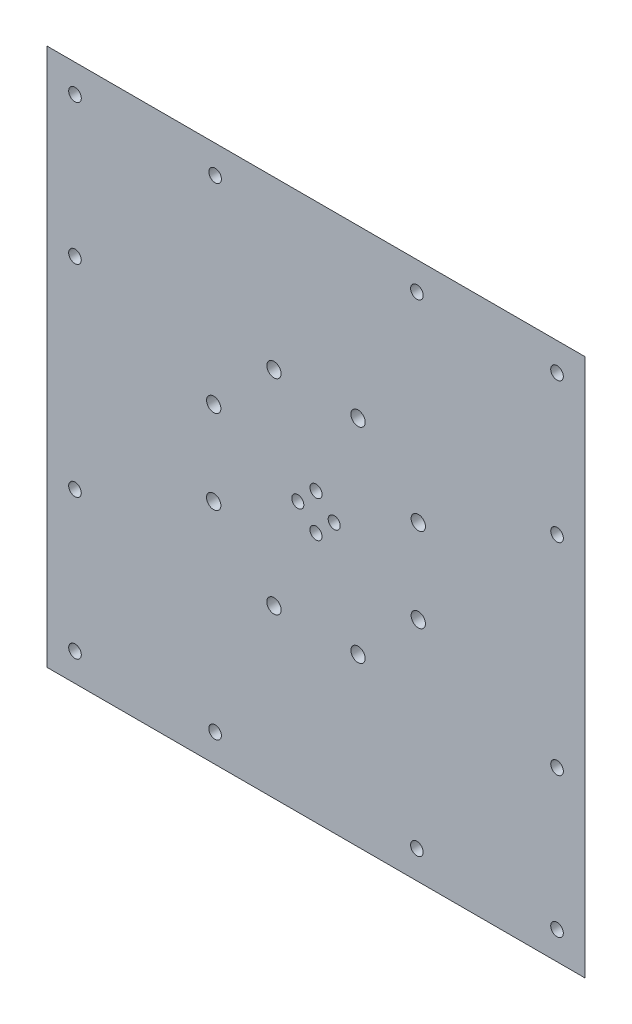
from build123d import *

# Parameters (mm, degrees)
SKETCH_1_W             = 200
SKETCH_1_H             = 200
EXTRUDE_1_DEPTH        = 3
SKETCH_5_W             = 200
SKETCH_5_H             = 200
EXTRUDE_2_DEPTH        = 3
SKETCH_2_R             = 2.55
SKETCH_2_R_2           = 2.15
CUT_EXTRUDE_1_DEPTH    = 10
CHAMFER_1_SIZE         = 10
HOLE_WIZARD_M4_1_D     = 4.5
HOLE_WIZARD_M4_1_DEPTH = 6
HOLE_WIZARD_M4_1_TIP   = 1.351936393


with BuildPart() as part:
    # 스케치1 → 보스-돌출1 (new body)
    with BuildSketch(Plane.XY):
        Rectangle(SKETCH_1_W, SKETCH_1_H)
    extrude(amount=EXTRUDE_1_DEPTH)

    # 스케치5 → 보스-돌출2 (add)
    with BuildSketch(Plane.XY.offset(3)):
        Rectangle(SKETCH_5_W, SKETCH_5_H)
    extrude(amount=EXTRUDE_2_DEPTH)

    # 스케치2 → 컷-돌출1 (cut)
    with BuildSketch(Plane.XY):
        with Locations((-36.5, 15)):
            Circle(SKETCH_2_R)
        with Locations((-36.5, -15)):
            Circle(SKETCH_2_R)
        with Locations((-6.5, 0)):
            Circle(SKETCH_2_R_2)
        with Locations((15, 36.5)):
            Circle(SKETCH_2_R)
        with Locations((-15, 36.5)):
            Circle(SKETCH_2_R)
        with Locations((0, 6.5)):
            Circle(SKETCH_2_R_2)
        with Locations((36.5, -15)):
            Circle(SKETCH_2_R)
        with Locations((36.5, 15)):
            Circle(SKETCH_2_R)
        with Locations((6.5, 0)):
            Circle(SKETCH_2_R_2)
        with Locations((-15, -36.5)):
            Circle(SKETCH_2_R)
        with Locations((15, -36.5)):
            Circle(SKETCH_2_R)
        with Locations((0, -6.5)):
            Circle(SKETCH_2_R_2)
    extrude(amount=CUT_EXTRUDE_1_DEPTH, mode=Mode.SUBTRACT)

    # 모따기1
    # the kernel refuses this chamfer: 10 mm, written as the material it takes off along each edge
    with BuildSketch(Plane(origin=(-125.71682988, 100, 0), x_dir=(0, 0.027495876610586317, 0.9996219169112968), z_dir=(1, 0, 0)), Plane(origin=(-100, -125.71682988, 0), x_dir=(-0.027495876610586317, 0, 0.9996219169112968), z_dir=(0, 1, 0)), Plane(origin=(100, 125.71682988, 0), x_dir=(0.027495876610586317, 0, 0.9996219169112968), z_dir=(0, -1, 0))) as chamfer_1_piece_1:
        Polygon((CHAMFER_1_SIZE * 0.999621916911, CHAMFER_1_SIZE * 0.0274958766106), (-CHAMFER_1_SIZE * 0.0274958766106, CHAMFER_1_SIZE * 0.999621916911), (0, 0), align=None)
    extrude(amount=251.433659759, mode=Mode.SUBTRACT)
    with BuildSketch(Plane(origin=(125.71682988, -100, 0), x_dir=(0, 0.9996219169112968, -0.027495876610586372), z_dir=(-1, 0, 0))) as chamfer_1_piece_2:
        Polygon((CHAMFER_1_SIZE * 0.999621916911, -CHAMFER_1_SIZE * 0.0274958766106), (-CHAMFER_1_SIZE * 0.0274958766106, -CHAMFER_1_SIZE * 0.999621916911), (0, 0), align=None)
    extrude(amount=251.433659759, mode=Mode.SUBTRACT)

    # M4 여유 구멍1
    with Locations(Plane.XY.offset(6)):
        with Locations((-86, -86), (-86, 86), (86, 86), (86, -86), (-86, -36), (-36, -86), (36, -86), (86, -36), (86, 36), (-36, 86), (36, 86), (-86, 36)):
            Hole(HOLE_WIZARD_M4_1_D / 2, depth=HOLE_WIZARD_M4_1_DEPTH)
            with Locations((0, 0, -(HOLE_WIZARD_M4_1_DEPTH + HOLE_WIZARD_M4_1_TIP / 2))):  # 118° drill point
                Cone(0, HOLE_WIZARD_M4_1_D / 2, HOLE_WIZARD_M4_1_TIP, mode=Mode.SUBTRACT)


solid = part.part
